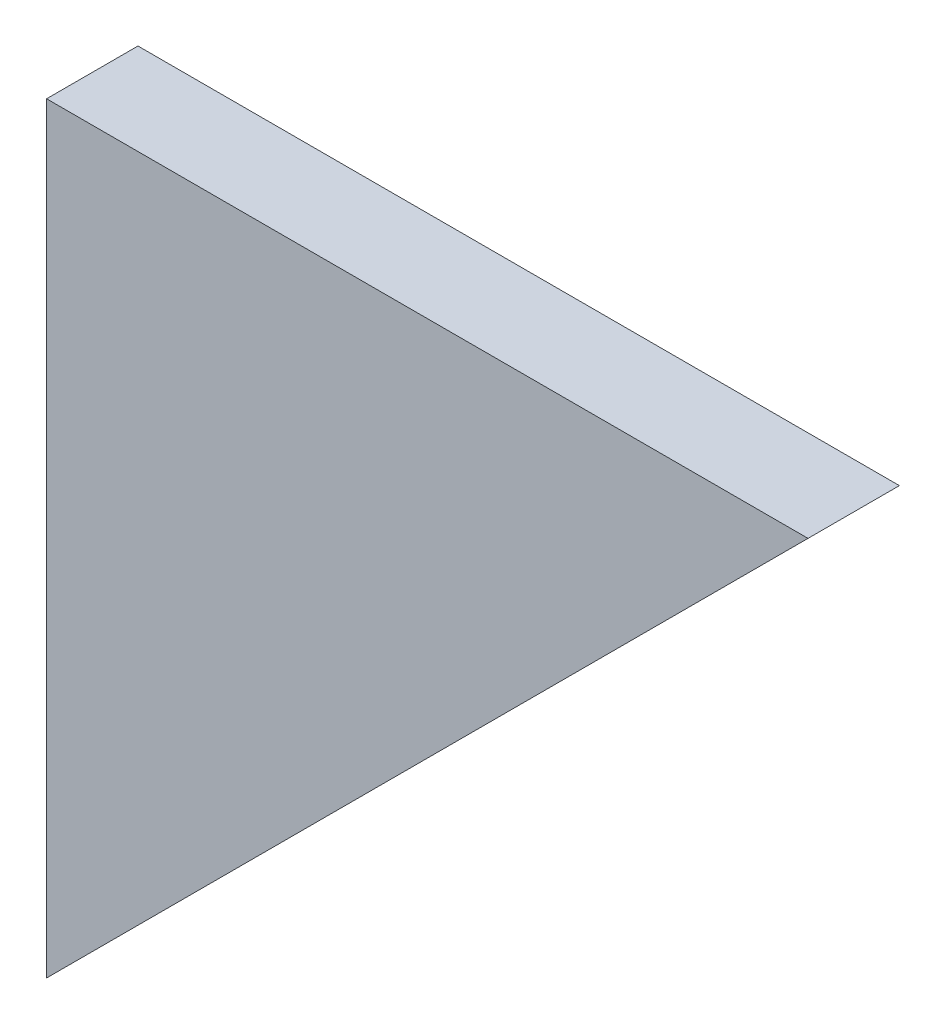
from build123d import *

# Parameters (mm, degrees)
EXTRUDE_1_DEPTH = 6


with BuildPart() as part:
    # Эскиз1 → Бобышка-Вытянуть1 (new body)
    with BuildSketch(Plane.XY):
        Polygon((6, -293.846153846), (6, -343.846153846), (56, -293.846153846), align=None)
    extrude(amount=-EXTRUDE_1_DEPTH)


solid = part.part
